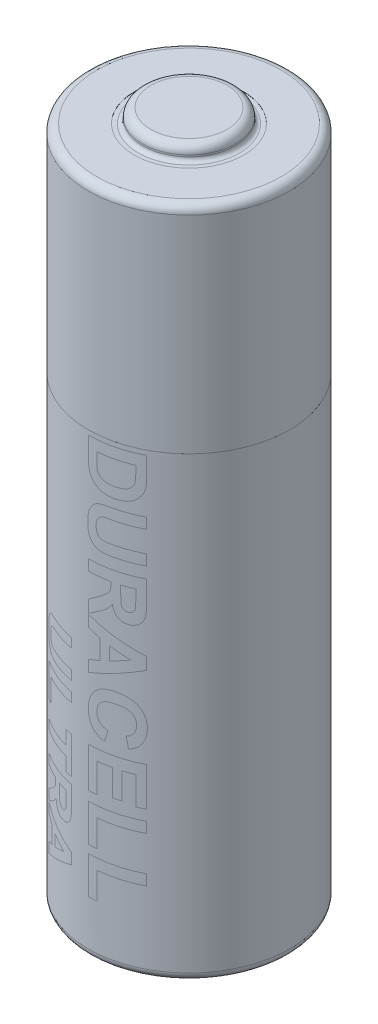
from build123d import *

# Parameters (mm, degrees)
SKETCH4_R      = 7.2505
SKETCH4_R_2    = 6.297708502
EXTRUDE3_DEPTH = 32.4


with BuildPart() as part:
    # Sketch1 → Revolve1 (revolve)
    with BuildSketch(Plane.XY):
        with BuildLine():
            Line((0, 49.25), (0, -1))
            Line((0, -1), (3.95, -1))
            ThreePointArc((3.95, -1), (4.162132034, -0.912132034), (4.25, -0.7))
            Line((4.25, -0.7), (4.25, -0.54))
            ThreePointArc((4.25, -0.54), (4.337867966, -0.327867966), (4.55, -0.24))
            Line((4.55, -0.24), (6.297708502, -0.24))
            Line((6.297708502, -0.24), (6.297708502, -0.25))
            Line((6.297708502, -0.25), (6.65, -0.25))
            ThreePointArc((6.65, -0.25), (7.074264069, -0.074264069), (7.25, 0.35))
            Line((7.25, 0.35), (7.25, 47.65))
            ThreePointArc((7.25, 47.65), (7.074264069, 48.074264069), (6.65, 48.25))
            Line((6.65, 48.25), (3.95, 48.25))
            Line((3.95, 48.25), (3.95, 48.23))
            Line((3.95, 48.23), (3.65, 48.23))
            ThreePointArc((3.65, 48.23), (3.437867966, 48.317867966), (3.35, 48.53))
            Line((3.35, 48.53), (3.35, 48.65))
            ThreePointArc((3.35, 48.65), (3.174264069, 49.074264069), (2.75, 49.25))
            Line((2.75, 49.25), (0, 49.25))
        make_face()
    revolve(axis=Axis((0, 7.581834893, 0), (0, -1, 0)))

    # Sketch4 → Extrude3 (add)
    with BuildSketch(Plane.XZ.offset(-0.35)):
        Circle(SKETCH4_R)
        Circle(SKETCH4_R_2, mode=Mode.SUBTRACT)
    extrude(amount=-EXTRUDE3_DEPTH)


solid = part.part
